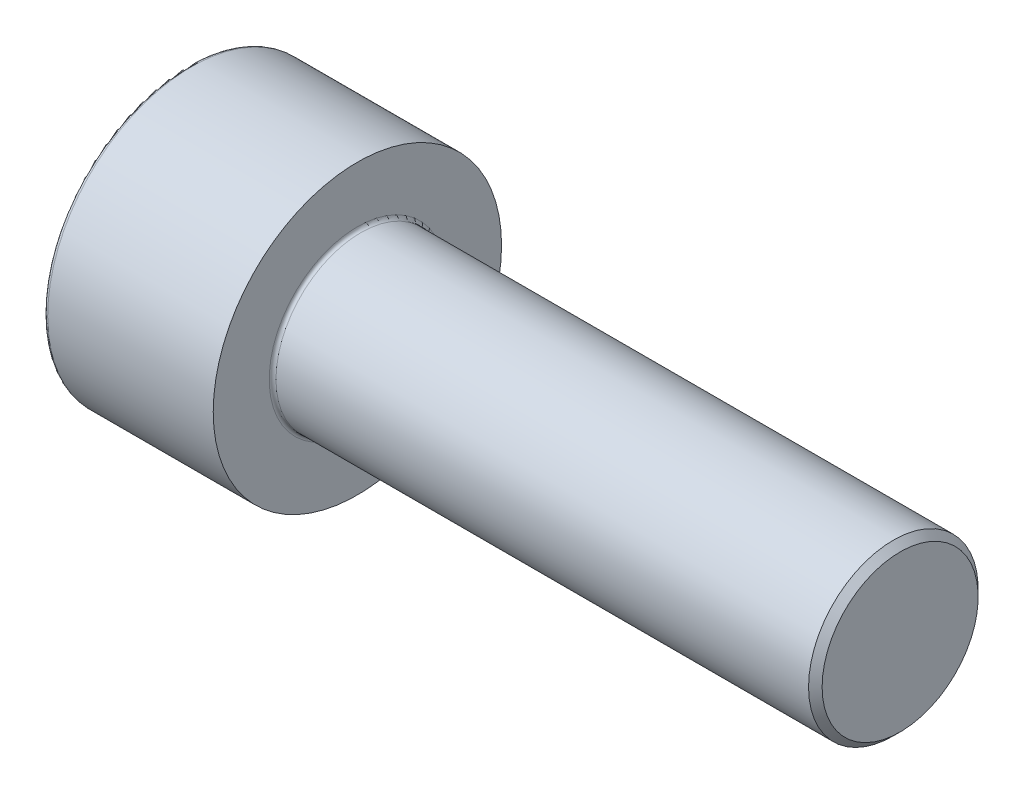
from build123d import *

# Parameters (mm, degrees)
REVOLVE1_OUTLINE_R     = 2.5
REVOLVE1_DEPTH         = 21
REVOLVE1_2_OUTLINE_R   = 4.25
REVOLVE1_2_OUTLINE_R_2 = 2.5
REVOLVE1_2_DEPTH       = 5
FILLET1_R              = 0.1
FILLET2_R              = 0.12
CHAMFER1_SIZE          = 0.2
EXTRUDE1_DEPTH         = 3.5


# Read off the part's stored shape, not the designer's step: Revolve1
with BuildPart() as part:
    # Revolve1 outline → Revolve1 (new body)
    with BuildSketch(Plane.YZ):
        Circle(REVOLVE1_OUTLINE_R)
    extrude(amount=REVOLVE1_DEPTH)

    # Revolve1 2 outline → Revolve1 2 (add)
    with BuildSketch(Plane.YZ):
        Circle(REVOLVE1_2_OUTLINE_R)
        Circle(REVOLVE1_2_OUTLINE_R_2, mode=Mode.SUBTRACT)
    extrude(amount=REVOLVE1_2_DEPTH)

    # Fillet1
    fillet1_edges = [part.edges().sort_by_distance(p)[0] for p in [
        (5, -2.5, 0),
    ]]
    fillet(fillet1_edges, radius=FILLET1_R)

    # Fillet2
    fillet2_edges = [part.edges().sort_by_distance(p)[0] for p in [
        (0, -4.25, 0),
    ]]
    fillet(fillet2_edges, radius=FILLET2_R)

    # Chamfer1
    chamfer1_edges = [part.edges().sort_by_distance(p)[0] for p in [
        (21, -2.5, 0),
    ]]
    chamfer(chamfer1_edges, length=CHAMFER1_SIZE)

    # Sketch2 → Extrude1 (cut)
    with BuildSketch(Plane.ZY):
        Polygon((0, 2.309401077), (-2, 1.154700538), (-2, -1.154700538), (0, -2.309401077), (2, -1.154700538), (2, 1.154700538), align=None)
    extrude(amount=-EXTRUDE1_DEPTH, mode=Mode.SUBTRACT)


solid = part.part
